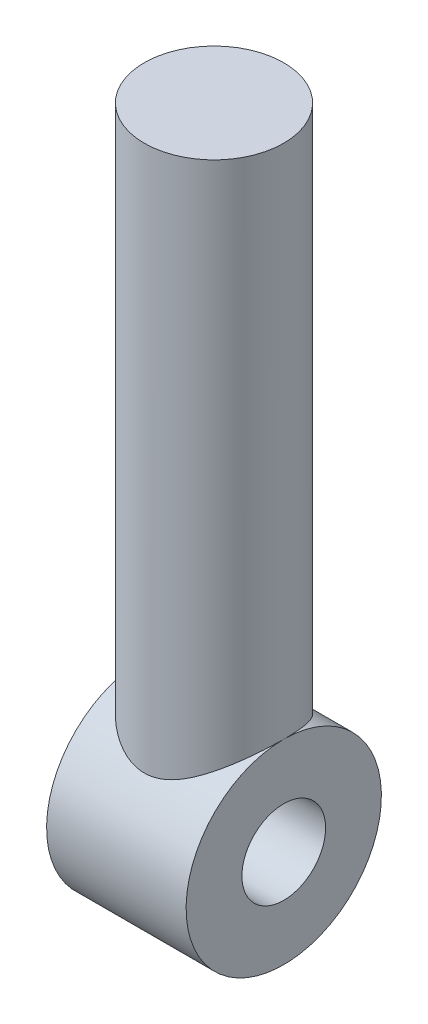
from build123d import *
from build123d.topology import SkipClean

# Parameters (mm, degrees)
SKETCH1_R                = 1.25
BOSS_EXTRUDE1_DEPTH      = 11
BOSS_EXTRUDE2_DEPTH      = 1.25
BOSS_EXTRUDE2_DEPTH_BACK = 1.25
SKETCH2_R                = 1.75
SKETCH3_R                = 0.75
CUT_EXTRUDE2_DEPTH       = 3


with BuildPart() as part:
    # Sketch1 → Boss-Extrude1 (new body)
    with BuildSketch(Plane(origin=(0, 0, 0), x_dir=(1, 0, 0), z_dir=(0, 1, 0))):
        Circle(SKETCH1_R)
    extrude(amount=BOSS_EXTRUDE1_DEPTH)

    # Sketch2 → Boss-Extrude2 (add, two sides: drawn at the far end of the back side and taken through both)
    with SkipClean():  # the faces are left unmerged after this step: merging them gives an invalid solid
        with BuildSketch(Plane(origin=(0, 0, 0), x_dir=(0, 0, -1), z_dir=(1, 0, 0)).offset(-BOSS_EXTRUDE2_DEPTH_BACK)):
            Circle(SKETCH2_R)
        extrude(amount=BOSS_EXTRUDE2_DEPTH + BOSS_EXTRUDE2_DEPTH_BACK)

    # Sketch3 → Cut-Extrude2 (cut)
    with SkipClean():  # the faces are left unmerged after this step: merging them gives an invalid solid
        with BuildSketch(Plane(origin=(1.25, 0, 0), x_dir=(0, 0, -1), z_dir=(1, 0, 0))):
            Circle(SKETCH3_R)
        extrude(amount=-CUT_EXTRUDE2_DEPTH, mode=Mode.SUBTRACT)


solid = part.part
